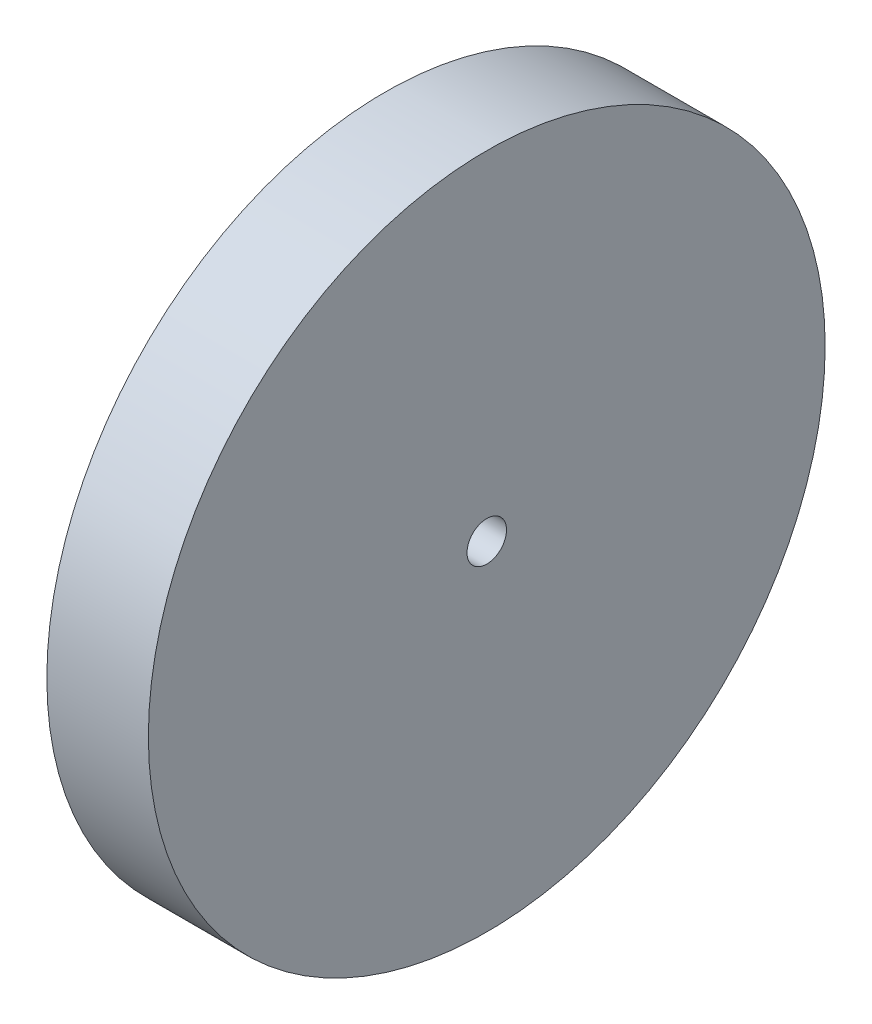
from build123d import *

# Parameters (mm, degrees)
SKETCH1_R           = 50
SKETCH1_R_2         = 2.916666667
BOSS_EXTRUDE1_DEPTH = 15


with BuildPart() as part:
    # Sketch1 → Boss-Extrude1 (new body)
    with BuildSketch(Plane(origin=(0, 0, 0), x_dir=(0, 0, -1), z_dir=(1, 0, 0))):
        Circle(SKETCH1_R)
        Circle(SKETCH1_R_2, mode=Mode.SUBTRACT)
    extrude(amount=BOSS_EXTRUDE1_DEPTH)


solid = part.part
